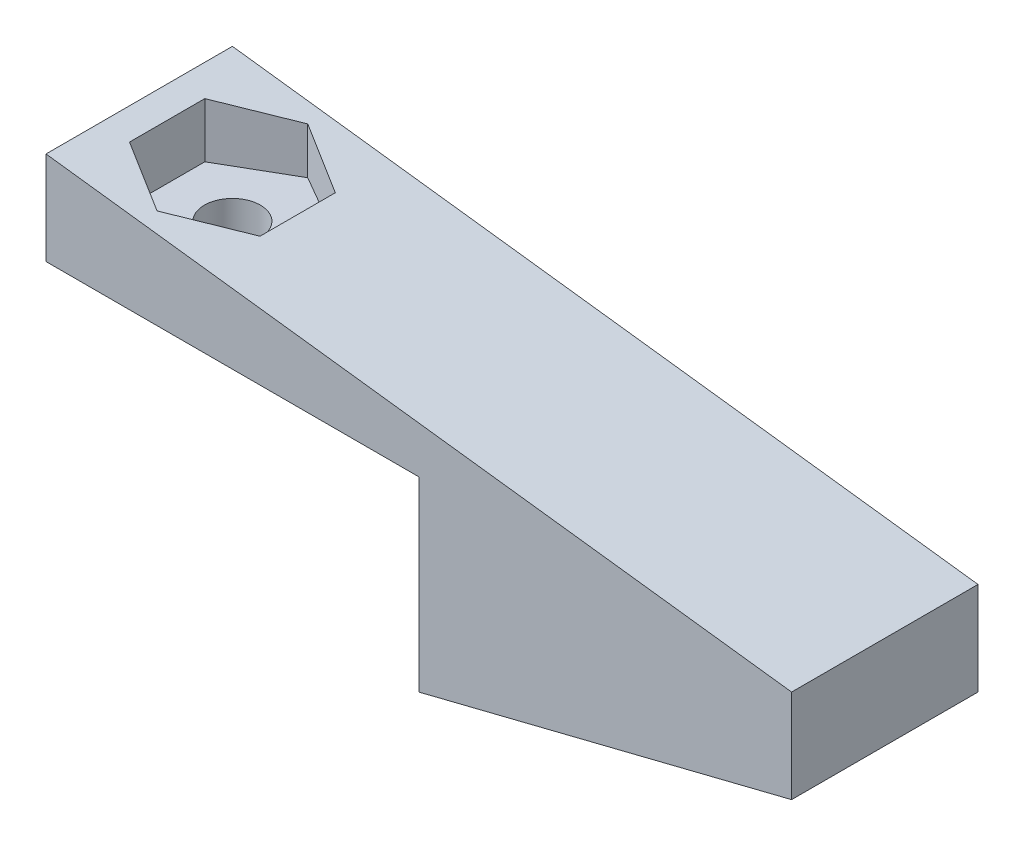
from build123d import *

# Parameters (mm, degrees)
BOSS_EXTRUDE1_DEPTH = 6.35
CUT_EXTRUDE1_REACH  = 54.747
SKETCH2_R           = 1.905
CUT_EXTRUDE2_REACH  = 57.128
CUT_EXTRUDE2_START  = -2.38125
SKETCH4_R           = 1.905
CUT_EXTRUDE3_DEPTH  = 15.875


with BuildPart() as part:
    # Sketch1 → Boss-Extrude1 (new, symmetric)
    with BuildSketch(Plane.XY):
        Polygon((0, 0), (0, 6.35), (50.8, 0), (50.8, -6.35), (25.4, -12.7), (25.4, 0), align=None)
    extrude(amount=BOSS_EXTRUDE1_DEPTH, both=True)

    # Sketch2 → Cut-Extrude1 (cut, up to next)
    with BuildSketch(Plane(origin=(0, 0, 0), x_dir=(-1, 0, 0), z_dir=(0, -1, 0)), mode=Mode.PRIVATE) as cut_extrude1_sk1:
        with Locations((-6.35, 0)):
            Circle(SKETCH2_R)
    cut_extrude1_tool1 = extrude(cut_extrude1_sk1.sketch, amount=-CUT_EXTRUDE1_REACH, mode=Mode.PRIVATE) & part.part
    add(cut_extrude1_tool1.solids().sort_by_distance((6.35, 0, 0))[0], mode=Mode.SUBTRACT)

    # Sketch3 → Cut-Extrude2 (cut, up to next)
    with BuildSketch(Plane.XZ.offset(CUT_EXTRUDE2_START), mode=Mode.PRIVATE) as cut_extrude2_sk1:
        Polygon((6.35, 5.132643893), (1.905, 2.566321947), (1.905, -2.566321947), (6.35, -5.132643893), (10.795, -2.566321947), (10.795, 2.566321947), align=None)
    cut_extrude2_tool1 = extrude(cut_extrude2_sk1.sketch, amount=-CUT_EXTRUDE2_REACH, mode=Mode.PRIVATE) & part.part
    add(cut_extrude2_tool1.solids().sort_by_distance((6.35, 2.38125, 0))[0], mode=Mode.SUBTRACT)

    # Sketch4 → Cut-Extrude3 (cut)
    with BuildSketch(Plane.ZY.offset(-25.4)):
        with Locations((0, -7.62)):
            Circle(SKETCH4_R)
    extrude(amount=-CUT_EXTRUDE3_DEPTH, mode=Mode.SUBTRACT)


solid = part.part
